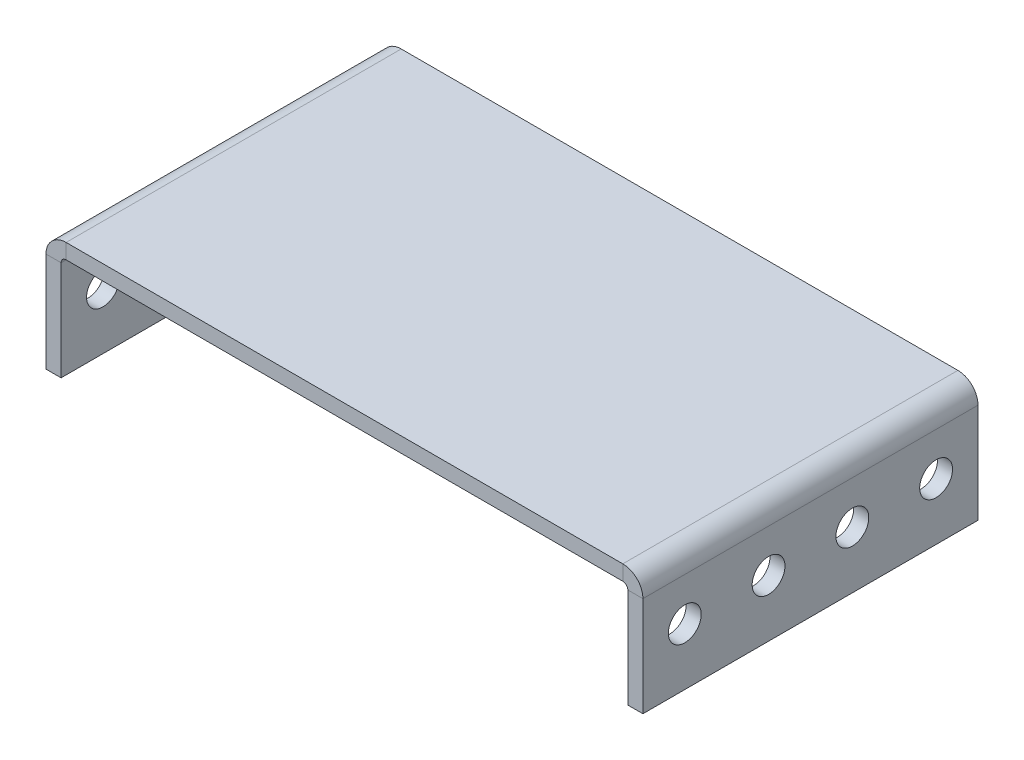
from build123d import *

# Parameters (mm, degrees)
BASE_FLANGE1_DEPTH      = 50.8
CUT_EXTRUDE1_DEPTH      = 69.790674268
CUT_EXTRUDE1_DEPTH_BACK = 69.790674268
SKETCH3_R               = 2.4892


# Sheet-metal steps are written as plain solids
with BuildPart() as part:
    # Sketch1 → Base-Flange1 (new body)
    with BuildSketch(Plane.XY):
        with BuildLine():
            Line((-42.95775, -7.9375), (-42.95775, 7.1755))
            ThreePointArc((-42.95775, 7.1755), (-42.734565367, 7.714315367), (-42.19575, 7.9375))
            Line((-42.19575, 7.9375), (42.19575, 7.9375))
            ThreePointArc((42.19575, 7.9375), (42.734565367, 7.714315367), (42.95775, 7.1755))
            Line((42.95775, 7.1755), (42.95775, -7.9375))
            Line((42.95775, -7.9375), (45.24375, -7.9375))
            Line((45.24375, -7.9375), (45.24375, 7.1755))
            ThreePointArc((45.24375, 7.1755), (44.351011469, 9.330761469), (42.19575, 10.2235))
            Line((42.19575, 10.2235), (-42.19575, 10.2235))
            ThreePointArc((-42.19575, 10.2235), (-44.351011469, 9.330761469), (-45.24375, 7.1755))
            Line((-45.24375, 7.1755), (-45.24375, -7.9375))
            Line((-45.24375, -7.9375), (-42.95775, -7.9375))
        make_face()
    extrude(amount=BASE_FLANGE1_DEPTH)

    # Sketch3 → Cut-Extrude1 (cut, two sides: drawn at the far end of the back side and taken through both)
    with BuildSketch(Plane(origin=(0, 0, 0), x_dir=(0, 0, -1), z_dir=(1, 0, 0)).offset(-CUT_EXTRUDE1_DEPTH_BACK)):
        with Locations((-6.35, 0.6985)):
            Circle(SKETCH3_R)
        with Locations((-19.05, 0.6985)):
            Circle(SKETCH3_R)
        with Locations((-31.75, 0.6985)):
            Circle(SKETCH3_R)
        with Locations((-44.45, 0.6985)):
            Circle(SKETCH3_R)
    extrude(amount=CUT_EXTRUDE1_DEPTH + CUT_EXTRUDE1_DEPTH_BACK, mode=Mode.SUBTRACT)


solid = part.part
